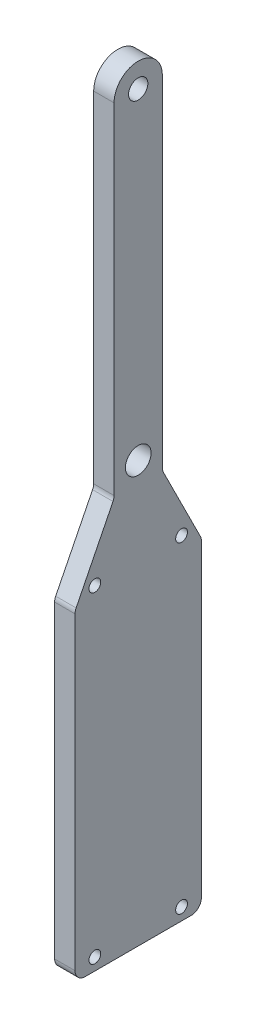
from build123d import *

# Parameters (mm, degrees)
SKETCH1_R           = 1.8288
SKETCH1_R_2         = 4
SKETCH1_R_3         = 3
BOSS_EXTRUDE1_DEPTH = 6.35
FILLET1_R           = 3.175


with BuildPart() as part:
    # Sketch1 → Boss-Extrude1 (new body)
    with BuildSketch(Plane(origin=(0, 0, 0), x_dir=(0, 0, -1), z_dir=(1, 0, 0))):
        with BuildLine():
            Line((19.639409497, -103.81), (19.639409497, -3.81))
            Line((19.639409497, -3.81), (7.5, 20.468818994))
            Line((7.5, 20.468818994), (7.5, 126.9494))
            ThreePointArc((7.5, 126.9494), (0, 134.4494), (-7.5, 126.9494))
            Line((-7.5, 126.9494), (-7.5, 20.468818994))
            Line((-7.5, 20.468818994), (-19.639409497, -3.81))
            Line((-19.639409497, -3.81), (-19.639409497, -103.81))
            Line((-19.639409497, -103.81), (19.639409497, -103.81))
        make_face()
        with Locations((-13.4747, -100)):
            Circle(SKETCH1_R, mode=Mode.SUBTRACT)
        with Locations((13.4747, -100)):
            Circle(SKETCH1_R, mode=Mode.SUBTRACT)
        with Locations((13.4747, 0)):
            Circle(SKETCH1_R, mode=Mode.SUBTRACT)
        with Locations((-13.4747, 0)):
            Circle(SKETCH1_R, mode=Mode.SUBTRACT)
        with Locations((0, 26.9494)):
            Circle(SKETCH1_R_2, mode=Mode.SUBTRACT)
        with Locations((0, 126.9494)):
            Circle(SKETCH1_R_3, mode=Mode.SUBTRACT)
    extrude(amount=BOSS_EXTRUDE1_DEPTH)

    # Fillet1
    fillet1_edges = [part.edges().sort_by_distance(p)[0] for p in [
        (3.175, 20.468818994, -7.5),
        (3.175, 20.468818994, 7.5),
        (3.175, -103.81, 19.639409497),
        (3.175, -103.81, -19.639409497),
        (3.175, -3.81, -19.639409497),
        (3.175, -3.81, 19.639409497),
    ]]
    fillet(fillet1_edges, radius=FILLET1_R)


solid = part.part
